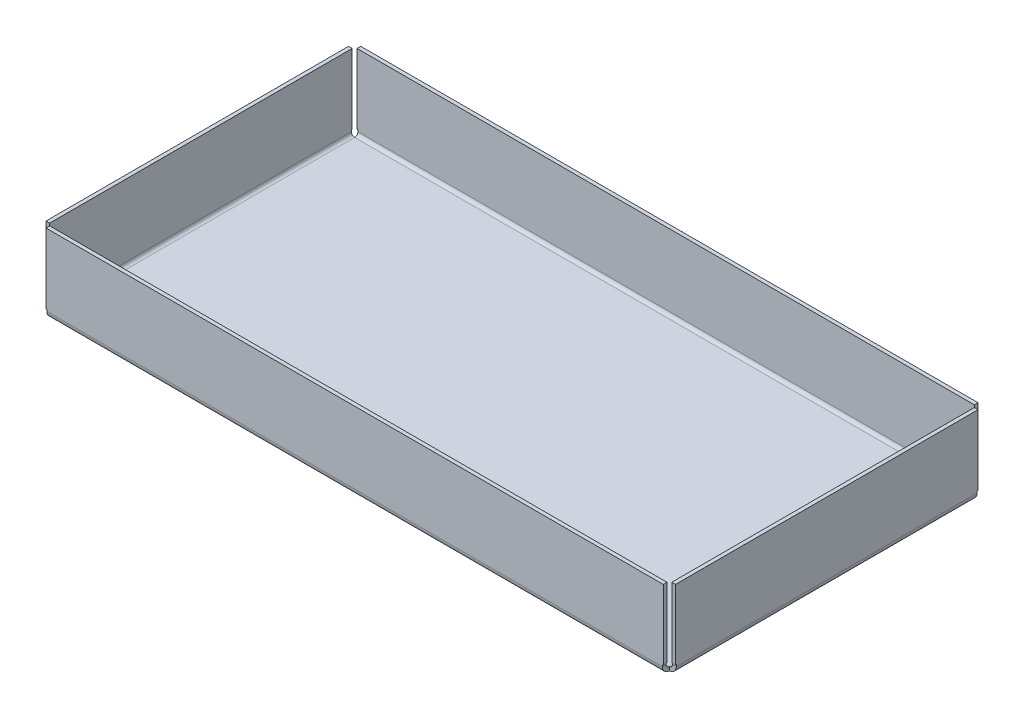
from build123d import *

# Parameters (mm, degrees)
SKETCH1_W              = 152.4
SKETCH1_H              = 76.2
BOSS_EXTRUDE1_DEPTH    = 19.05
CONVERT_SOLID1_START   = -74.5236
CONVERT_SOLID1_DEPTH   = 72.8472
CONVERT_SOLID1_START_2 = -77
CONVERT_SOLID1_2_DEPTH = 2.273736392
CONVERT_SOLID1_START_3 = -1.473736392
CONVERT_SOLID1_3_DEPTH = 2.473736392
CONVERT_SOLID1_START_4 = -74.726263608
CONVERT_SOLID1_4_DEPTH = 73.252527216
CONVERT_SOLID1_5_DEPTH = 0.202663608
CONVERT_SOLID1_START_5 = -1.6764
CONVERT_SOLID1_6_DEPTH = 0.202663608
CONVERT_SOLID1_START_6 = 1.473736392
CONVERT_SOLID1_7_DEPTH = 149.452527216


with BuildPart() as part:
    # Sketch1 → Boss-Extrude1 (new body)
    with BuildSketch(Plane(origin=(0, 0, 0), x_dir=(1, 0, 0), z_dir=(0, 1, 0))):
        with Locations((76.2, 38.1)):
            Rectangle(SKETCH1_W, SKETCH1_H)
    extrude(amount=BOSS_EXTRUDE1_DEPTH)

    # Convert-Solid1: read off the stored shape, not the designer's step
    # Convert-Solid1 outline → Convert-Solid1 (cut)
    with BuildSketch(Plane.XY.offset(CONVERT_SOLID1_START)):
        with BuildLine():
            Line((151.511, 19.05), (0.889, 19.05))
            Line((0.889, 19.05), (0.889, 1.6764))
            ThreePointArc((0.889, 1.6764), (1.11962412, 1.11962412), (1.6764, 0.889))
            Line((1.6764, 0.889), (150.7236, 0.889))
            ThreePointArc((150.7236, 0.889), (151.28037588, 1.11962412), (151.511, 1.6764))
            Line((151.511, 1.6764), (151.511, 19.05))
        make_face()
        with BuildLine():
            ThreePointArc((152.4, 1.6764), (151.908993808, 0.491006192), (150.7236, 0))
            Line((150.7236, 0), (152.4, 0))
            Line((152.4, 0), (152.4, 1.6764))
        make_face()
        with BuildLine():
            Line((0, 0), (1.6764, 0))
            ThreePointArc((1.6764, 0), (0.491006192, 0.491006192), (0, 1.6764))
            Line((0, 1.6764), (0, 0))
        make_face()
    extrude(amount=CONVERT_SOLID1_DEPTH, mode=Mode.SUBTRACT)

    # Convert-Solid1 2 outline → Convert-Solid1 2 (cut)
    with BuildSketch(Plane.XY.offset(CONVERT_SOLID1_START_2)):
        Polygon((150.926263608, 2.11106664), (150.7236, 2.11106664), (150.7236, 0), (152.4, 0), (152.4, 19.05), (150.926263608, 19.05), align=None)
        Polygon((1.473736392, 19.05), (0, 19.05), (0, 0), (1.6764, 0), (1.6764, 2.11106664), (1.473736392, 2.11106664), align=None)
    extrude(amount=CONVERT_SOLID1_2_DEPTH, mode=Mode.SUBTRACT)

    # Convert-Solid1 3 outline → Convert-Solid1 3 (cut)
    with BuildSketch(Plane.XY.offset(CONVERT_SOLID1_START_3)):
        Polygon((150.926263608, 2.11106664), (150.7236, 2.11106664), (150.7236, 0), (152.4, 0), (152.4, 19.05), (150.926263608, 19.05), align=None)
        Polygon((1.473736392, 19.05), (0, 19.05), (0, 0), (1.6764, 0), (1.6764, 2.11106664), (1.473736392, 2.11106664), align=None)
    extrude(amount=CONVERT_SOLID1_3_DEPTH, mode=Mode.SUBTRACT)

    # Convert-Solid1 4 outline → Convert-Solid1 4 (cut)
    with BuildSketch(Plane.XY.offset(CONVERT_SOLID1_START_4)):
        with BuildLine():
            Line((150.926263608, 2.11106664), (150.7236, 2.11106664))
            Line((150.7236, 2.11106664), (150.7236, 0.889))
            ThreePointArc((150.7236, 0.889), (151.28037588, 1.11962412), (151.511, 1.6764))
            Line((151.511, 1.6764), (151.511, 19.05))
            Line((151.511, 19.05), (150.926263608, 19.05))
            Line((150.926263608, 19.05), (150.926263608, 2.11106664))
        make_face()
        with BuildLine():
            ThreePointArc((152.4, 1.6764), (151.908993808, 0.491006192), (150.7236, 0))
            Line((150.7236, 0), (152.4, 0))
            Line((152.4, 0), (152.4, 1.6764))
        make_face()
        with BuildLine():
            ThreePointArc((0.889, 1.6764), (1.11962412, 1.11962412), (1.6764, 0.889))
            Line((1.6764, 0.889), (1.6764, 2.11106664))
            Line((1.6764, 2.11106664), (1.473736392, 2.11106664))
            Line((1.473736392, 2.11106664), (1.473736392, 19.05))
            Line((1.473736392, 19.05), (0.889, 19.05))
            Line((0.889, 19.05), (0.889, 1.6764))
        make_face()
        with BuildLine():
            Line((0, 0), (1.6764, 0))
            ThreePointArc((1.6764, 0), (0.491006192, 0.491006192), (0, 1.6764))
            Line((0, 1.6764), (0, 0))
        make_face()
    extrude(amount=CONVERT_SOLID1_4_DEPTH, mode=Mode.SUBTRACT)

    # Convert-Solid1 5 outline → Convert-Solid1 5 (cut)
    with BuildSketch(Plane.XY.offset(CONVERT_SOLID1_START_4)):
        with BuildLine():
            ThreePointArc((151.511, 1.6764), (151.28037588, 1.11962412), (150.7236, 0.889))
            Line((150.7236, 0.889), (150.7236, 0))
            ThreePointArc((150.7236, 0), (151.908993808, 0.491006192), (152.4, 1.6764))
            Line((152.4, 1.6764), (152.4, 2.11106664))
            Line((152.4, 2.11106664), (151.511, 2.11106664))
            Line((151.511, 2.11106664), (151.511, 1.6764))
        make_face()
        with BuildLine():
            Line((1.6764, 0), (1.6764, 0.889))
            ThreePointArc((1.6764, 0.889), (1.11962412, 1.11962412), (0.889, 1.6764))
            Line((0.889, 1.6764), (0.889, 2.11106664))
            Line((0.889, 2.11106664), (0, 2.11106664))
            Line((0, 2.11106664), (0, 1.6764))
            ThreePointArc((0, 1.6764), (0.491006192, 0.491006192), (1.6764, 0))
        make_face()
    extrude(amount=CONVERT_SOLID1_5_DEPTH, mode=Mode.SUBTRACT)

    # Convert-Solid1 6 outline → Convert-Solid1 6 (cut)
    with BuildSketch(Plane.XY.offset(CONVERT_SOLID1_START_5)):
        with BuildLine():
            ThreePointArc((151.511, 1.6764), (151.28037588, 1.11962412), (150.7236, 0.889))
            Line((150.7236, 0.889), (150.7236, 0))
            ThreePointArc((150.7236, 0), (151.908993808, 0.491006192), (152.4, 1.6764))
            Line((152.4, 1.6764), (152.4, 2.11106664))
            Line((152.4, 2.11106664), (151.511, 2.11106664))
            Line((151.511, 2.11106664), (151.511, 1.6764))
        make_face()
        with BuildLine():
            Line((1.6764, 0), (1.6764, 0.889))
            ThreePointArc((1.6764, 0.889), (1.11962412, 1.11962412), (0.889, 1.6764))
            Line((0.889, 1.6764), (0.889, 2.11106664))
            Line((0.889, 2.11106664), (0, 2.11106664))
            Line((0, 2.11106664), (0, 1.6764))
            ThreePointArc((0, 1.6764), (0.491006192, 0.491006192), (1.6764, 0))
        make_face()
    extrude(amount=CONVERT_SOLID1_6_DEPTH, mode=Mode.SUBTRACT)

    # Convert-Solid1 7 outline → Convert-Solid1 7 (cut)
    with BuildSketch(Plane.YZ.offset(CONVERT_SOLID1_START_6)):
        with BuildLine():
            Line((0, 0), (0, -1.6764))
            ThreePointArc((0, -1.6764), (0.491006192, -0.491006192), (1.6764, 0))
            Line((1.6764, 0), (0, 0))
        make_face()
        with BuildLine():
            ThreePointArc((1.6764, -76.2), (0.491006192, -75.708993808), (0, -74.5236))
            Line((0, -74.5236), (0, -76.2))
            Line((0, -76.2), (1.6764, -76.2))
        make_face()
        with BuildLine():
            Line((19.05, -74.5236), (0.889, -74.5236))
            ThreePointArc((0.889, -74.5236), (1.11962412, -75.08037588), (1.6764, -75.311))
            Line((1.6764, -75.311), (19.05, -75.311))
            Line((19.05, -75.311), (19.05, -74.5236))
        make_face()
        with BuildLine():
            Line((0.889, -1.6764), (19.05, -1.6764))
            Line((19.05, -1.6764), (19.05, -0.889))
            Line((19.05, -0.889), (1.6764, -0.889))
            ThreePointArc((1.6764, -0.889), (1.11962412, -1.11962412), (0.889, -1.6764))
        make_face()
    extrude(amount=CONVERT_SOLID1_7_DEPTH, mode=Mode.SUBTRACT)


solid = part.part
